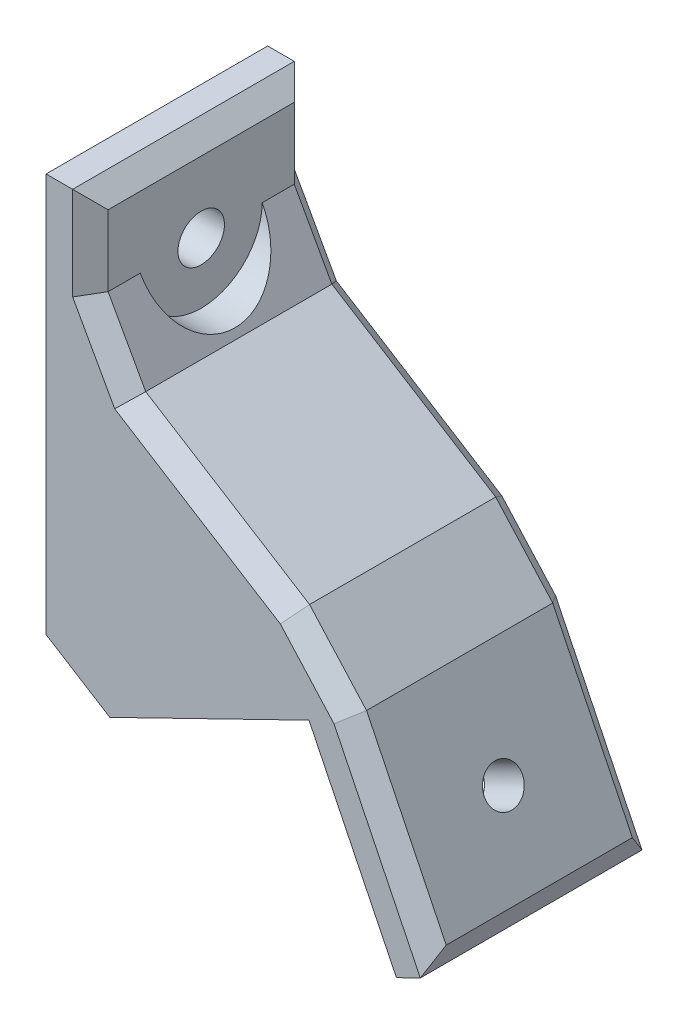
from build123d import *

# Parameters (mm, degrees)
BOSS_EXTRU_1_DEPTH      = 20
ESQUISSE2_W             = 20
ESQUISSE2_H             = 20
BOSS_EXTRU_2_DEPTH      = 4
ESQUISSE3_W             = 20
ESQUISSE3_H             = 20
BOSS_EXTRU_3_DEPTH      = 4
BOSS_EXTRU_4_DEPTH      = 20
CHANFREIN1_SIZE         = 4
ESQUISSE5_R             = 2.1
ENL_V_MAT_EXTRU_1_DEPTH = 55.18590116
ESQUISSE6_R             = 5.5
ENL_V_MAT_EXTRU_2_DEPTH = 52.675817418
D_GAGEMENT_41_D         = 3.4544
D_GAGEMENT_41_DEPTH     = 10
D_GAGEMENT_41_TIP       = 1.037806461
CHANFREIN2_SIZE         = 1.6


with BuildPart() as part:
    # Esquisse1 → Boss.-Extru.1 (new body)
    with BuildSketch(Plane.XY):
        Polygon((0, 0), (0, 20), (17.975880926, 8.767422936), align=None)
    extrude(amount=BOSS_EXTRU_1_DEPTH)

    # Esquisse2 → Boss.-Extru.2 (add)
    with BuildSketch(Plane.ZY):
        with Locations((10, 10)):
            Rectangle(ESQUISSE2_W, ESQUISSE2_H)
    extrude(amount=BOSS_EXTRU_2_DEPTH)

    # Esquisse3 → Boss.-Extru.3 (add)
    with BuildSketch(Plane(origin=(0, 0, 0), x_dir=(0.8987940462991649, 0.4383711467890818, 0), z_dir=(0.43837114678908173, -0.8987940462991648, 0))):
        with Locations((10, 10)):
            Rectangle(ESQUISSE3_W, ESQUISSE3_H)
    extrude(amount=BOSS_EXTRU_3_DEPTH)

    # Esquisse4 → Boss.-Extru.4 (add)
    with BuildSketch(Plane.XY.offset(20)):
        Polygon((-4, 36), (-4, 20), (0, 20), (17.975880926, 8.767422936), (27.620046155, -11.006046083), (31.215222341, -9.252561496), (21.571057111, 10.520907523), (0, 24), (0, 36), align=None)
        Polygon((0, 0), (-4, 0), (1.753484587, -3.595176185), align=None)
    extrude(amount=-BOSS_EXTRU_4_DEPTH)

    # Chanfrein1
    chanfrein1_edges = [part.edges().sort_by_distance(p)[0] for p in [
        (0, 24, 10),
        (21.571057111, 10.520907523, 10),
    ]]
    chamfer(chanfrein1_edges, length=CHANFREIN1_SIZE)

    # Esquisse5 → Enlèv. mat.-Extru.1 (cut, through all)
    with BuildSketch(Plane.ZY.offset(4)):
        with Locations((10, 28)):
            Circle(ESQUISSE5_R)
    extrude(amount=-ENL_V_MAT_EXTRU_1_DEPTH, mode=Mode.SUBTRACT)

    # Esquisse6 → Enlèv. mat.-Extru.2 (cut, through all)
    with BuildSketch(Plane(origin=(0, 0, 0), x_dir=(0, 0, -1), z_dir=(1, 0, 0))):
        with Locations((-10, 28)):
            Circle(ESQUISSE6_R)
    extrude(amount=ENL_V_MAT_EXTRU_2_DEPTH, mode=Mode.SUBTRACT)

    # Dégagement #41
    with Locations(Plane(origin=(21.571057111, 10.520907523, 0), x_dir=(0, 0, -1), z_dir=(0.8987940462991659, 0.4383711467890799, 0))):
        with Locations((-10, -13)):
            Hole(D_GAGEMENT_41_D / 2, depth=D_GAGEMENT_41_DEPTH)
            with Locations((0, 0, -(D_GAGEMENT_41_DEPTH + D_GAGEMENT_41_TIP / 2))):  # 118° drill point
                Cone(0, D_GAGEMENT_41_D / 2, D_GAGEMENT_41_TIP, mode=Mode.SUBTRACT)

    # Chanfrein2
    chanfrein2_edges = [part.edges().sort_by_distance(p)[0] for p in [
        (0, 32, 0),
        (0, 36, 10),
        (0, 32, 20),
        (1.696096192, 24.940161472, 0),
        (10.785528556, 17.260453761, 0),
        (20.751703212, 9.783157959, 0),
        (27.269882019, -1.163415079, 0),
        (31.215222341, -9.252561496, 10),
        (27.269882019, -1.163415079, 20),
        (20.751703212, 9.783157959, 20),
        (10.785528556, 17.260453761, 20),
        (1.696096192, 24.940161472, 20),
    ]]
    chamfer(chanfrein2_edges, length=CHANFREIN2_SIZE)


solid = part.part
